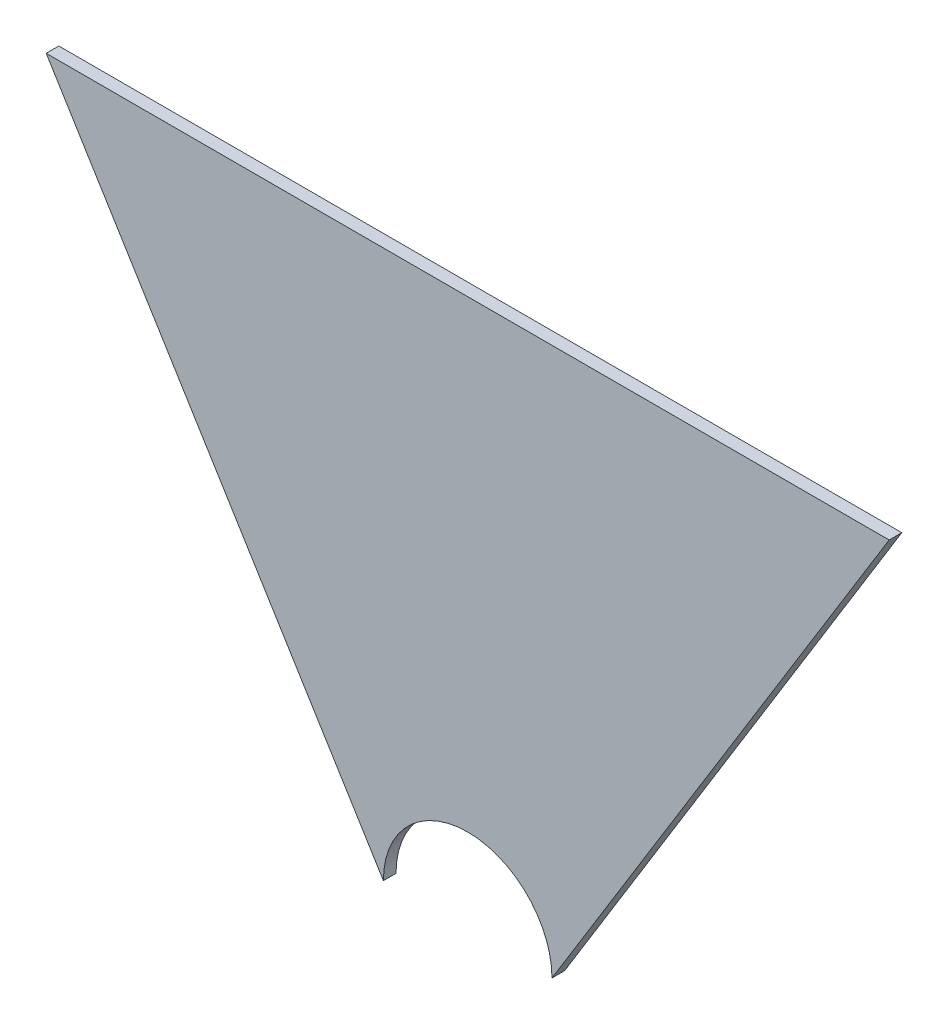
from build123d import *

# Parameters (mm, degrees)
BASE_FLANGE1_DEPTH = 3


# Sheet-metal steps are written as plain solids
with BuildPart() as part:
    # Sketch1 → Base-Flange1 (new body)
    with BuildSketch(Plane.XY):
        with BuildLine():
            Line((0, 0), (200, 0))
            Line((200, 0), (120, -130))
            ThreePointArc((120, -130), (100, -110), (80, -130))
            Line((80, -130), (0, 0))
        make_face()
    extrude(amount=-BASE_FLANGE1_DEPTH)


solid = part.part
